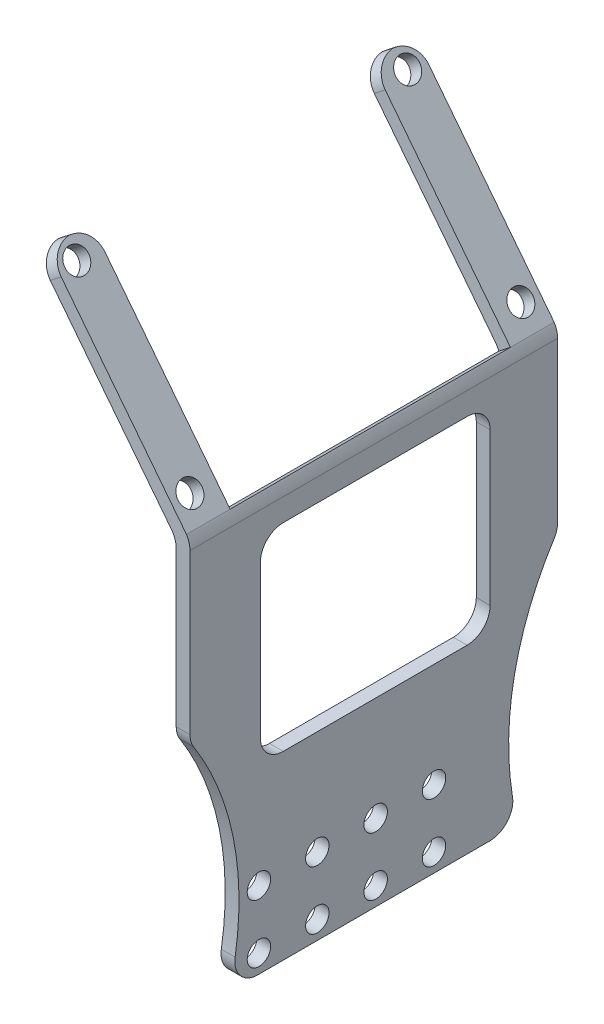
from build123d import *

# Parameters (mm, degrees)
SKETCH_1_W          = 3
SKETCH_1_H          = 90
EXTRUDE_1_DEPTH     = 80
SKETCH_2_R          = 2.6
CUT_EXTRUDE_1_DEPTH = 118.276484819
SKETCH_3_W          = 49.268401117
SKETCH_3_H          = 61
CUT_EXTRUDE_2_DEPTH = 118.276484819
SKETCH_4_R          = 2.55
CUT_EXTRUDE_3_DEPTH = 121.608375453
CUT_EXTRUDE_4_DEPTH = 121.608375453
FILLET_2_R          = 5
SKETCH_6_W          = 50
SKETCH_6_H          = 43.1
CUT_EXTRUDE_6_DEPTH = 121.608375453
FILLET_3_R          = 5


with BuildPart() as part:
    # 草图1 → 凸台-拉伸1 (new body)
    with BuildSketch(Plane.XY):
        Polygon((-1.18201613, 42.576507787), (-31.965089897, 81.977045467), (-29.601057636, 83.824029893), (1.18201613, 44.423492213), align=None)
        Rectangle(SKETCH_1_W, SKETCH_1_H)
    extrude(amount=EXTRUDE_1_DEPTH)

    # 草图2 → 切除-拉伸1 (cut, through all)
    with BuildSketch(Plane(origin=(22.285948177, 17.411690984, 0), x_dir=(0.6156614753256597, -0.788010753606721, 0), z_dir=(0.788010753606721, 0.6156614753256597, 0))):
        with Locations(Location((-80.278467782, -4, 0), (0, 0, 180))):
            Circle(SKETCH_2_R)
        with Locations(Location((-80.278467782, -76, 0), (0, 0, 180))):
            Circle(SKETCH_2_R)
        with Locations(Location((-40.278467782, -4, 0), (0, 0, 180))):
            Circle(SKETCH_2_R)
        with Locations(Location((-40.278467782, -76, 0), (0, 0, 180))):
            Circle(SKETCH_2_R)
    extrude(amount=-CUT_EXTRUDE_1_DEPTH, mode=Mode.SUBTRACT)

    # 草图3 → 切除-拉伸2 (cut, through all)
    with BuildSketch(Plane(origin=(22.285948177, 17.411690984, 0), x_dir=(0.6156614753256597, -0.788010753606721, 0), z_dir=(0.788010753606721, 0.6156614753256597, 0))):
        with Locations((-59.644267224, -40)):
            Rectangle(SKETCH_3_W, SKETCH_3_H)
    extrude(amount=-CUT_EXTRUDE_2_DEPTH, mode=Mode.SUBTRACT)

    # 草图4 → 切除-拉伸3 (cut, through all)
    with BuildSketch(Plane(origin=(1.5, 0, 0), x_dir=(0, 0, -1), z_dir=(1, 0, 0))):
        with Locations(Location((-65, -28.3, 0), (0, 0, 90))):
            Circle(SKETCH_4_R)
        with Locations(Location((-65, -41, 0), (0, 0, 90))):
            Circle(SKETCH_4_R)
        with Locations(Location((-52.3, -28.3, 0), (0, 0, 90))):
            Circle(SKETCH_4_R)
        with Locations(Location((-52.3, -41, 0), (0, 0, 90))):
            Circle(SKETCH_4_R)
        with Locations(Location((-39.6, -28.3, 0), (0, 0, 90))):
            Circle(SKETCH_4_R)
        with Locations(Location((-39.6, -41, 0), (0, 0, 90))):
            Circle(SKETCH_4_R)
        with Locations(Location((-26.9, -28.3, 0), (0, 0, 90))):
            Circle(SKETCH_4_R)
        with Locations(Location((-26.9, -41, 0), (0, 0, 90))):
            Circle(SKETCH_4_R)
    extrude(amount=-CUT_EXTRUDE_3_DEPTH, mode=Mode.SUBTRACT)

    # 草图5 → 切除-拉伸4 (cut, through all)
    with BuildSketch(Plane(origin=(1.5, 0, 0), x_dir=(0, 0, -1), z_dir=(1, 0, 0))):
        with BuildLine():
            Line((-80, 6.141923624), (-80, -45))
            Line((-80, -45), (-71.424177932, -45))
            ThreePointArc((-71.424177932, -45), (-70.206204317, -18.505774381), (-80, 6.141923624))
        make_face()
        with BuildLine():
            Line((0, -45), (-8.575822068, -45))
            ThreePointArc((-8.575822068, -45), (-9.793795683, -18.505774381), (0, 6.141923624))
            Line((0, 6.141923624), (0, -45))
        make_face()
    extrude(amount=-CUT_EXTRUDE_4_DEPTH, mode=Mode.SUBTRACT)

    # 圆角2
    # the kernel refuses this fillet: 5 mm, written as the material it adds along each edge
    with BuildSketch(Plane(origin=(-1.5, 42.98350858, 80), x_dir=(-0.61566147532566, 0.7880107536067206, 0), z_dir=(0, 0, -1))) as fillet_2_piece_1_section:
        with BuildLine():
            CenterArc((FILLET_2_R * 0.34432761329, -FILLET_2_R), FILLET_2_R, 90, 38)
            Line((-FILLET_2_R * 0.271333862036, -FILLET_2_R * 0.211989246393), (0, 0))
            Line((0, 0), (FILLET_2_R * 0.34432761329, 0))
        make_face()
    fillet_2_piece_1 = extrude(amount=84.304095166, mode=Mode.PRIVATE)
    fillet_2_piece_1 = split(fillet_2_piece_1, bisect_by=Plane(origin=(-1.5, 42.98350858, 70.5), z_dir=(0, 0, 1)), keep=Keep.TOP, mode=Mode.PRIVATE)
    add(fillet_2_piece_1)
    with BuildSketch(Plane(origin=(-1.5, 42.98350858, 84.304095166), x_dir=(-0.61566147532566, 0.7880107536067206, 0), z_dir=(0, 0, -1))) as fillet_2_piece_2_section:
        with BuildLine():
            CenterArc((FILLET_2_R * 0.34432761329, -FILLET_2_R), FILLET_2_R, 90, 38)
            Line((-FILLET_2_R * 0.271333862036, -FILLET_2_R * 0.211989246393), (0, 0))
            Line((0, 0), (FILLET_2_R * 0.34432761329, 0))
        make_face()
    fillet_2_piece_2 = extrude(amount=84.304095166, mode=Mode.PRIVATE)
    fillet_2_piece_2 = split(fillet_2_piece_2, bisect_by=Plane(origin=(-1.632433378, 43.153015574, 84.304095166), z_dir=(0.6156614753256597, -0.7880107536067209, 0)), keep=Keep.TOP, mode=Mode.PRIVATE)
    fillet_2_piece_2 = split(fillet_2_piece_2, bisect_by=Plane(origin=(-1.5, 42.98350858, 70.5), z_dir=(0, 0, -1)), keep=Keep.TOP, mode=Mode.PRIVATE)
    add(fillet_2_piece_2)
    with BuildSketch(Plane(origin=(-1.5, 42.98350858, 84.304095166), x_dir=(-0.61566147532566, 0.7880107536067206, 0), z_dir=(0, 0, -1))) as fillet_2_piece_3_section:
        with BuildLine():
            CenterArc((FILLET_2_R * 0.34432761329, -FILLET_2_R), FILLET_2_R, 90, 38)
            Line((-FILLET_2_R * 0.271333862036, -FILLET_2_R * 0.211989246393), (0, 0))
            Line((0, 0), (FILLET_2_R * 0.34432761329, 0))
        make_face()
    fillet_2_piece_3 = extrude(amount=84.304095166, mode=Mode.PRIVATE)
    fillet_2_piece_3 = split(fillet_2_piece_3, bisect_by=Plane(origin=(-1.5, 42.98350858, 9.5), z_dir=(0, 0, -1)), keep=Keep.TOP, mode=Mode.PRIVATE)
    add(fillet_2_piece_3)
    # the kernel refuses this fillet: 5 mm, written as the material it takes off along each edge
    with BuildSketch(Plane(origin=(1.5, 45, -6.658439614), x_dir=(0, -1, 0), z_dir=(0, 0, 1))) as fillet_2_2_piece_1:
        with BuildLine():
            CenterArc((2.663375846, -5), FILLET_2_R, 90, 32.186384057)
            Line((0, -0.768401117), (0, 0))
            Line((0, 0), (2.663375846, 0))
        make_face()
    extrude(amount=93.316879228, mode=Mode.SUBTRACT)

    # 草图6 → 切除-拉伸6 (cut, through all)
    with BuildSketch(Plane(origin=(1.5, 0, 0), x_dir=(0, 0, -1), z_dir=(1, 0, 0))):
        with Locations((-39.698542008, 15.9)):
            Rectangle(SKETCH_6_W, SKETCH_6_H)
    extrude(amount=-CUT_EXTRUDE_6_DEPTH, mode=Mode.SUBTRACT)

    # 圆角3
    # the kernel refuses this fillet: 5 mm, written as the material it adds along each edge
    with BuildSketch(Plane(origin=(1.5, -5.65, 14.698542008), x_dir=(0, 1, 0), z_dir=(-1, 0, 0)), Plane(origin=(1.5, -5.65, 64.698542008), x_dir=(0, 0, -1), z_dir=(-1, 0, 0)), Plane(origin=(1.5, 37.45, 64.698542008), x_dir=(0, -1, 0), z_dir=(-1, 0, 0))) as fillet_3_piece_1:
        with BuildLine():
            CenterArc((FILLET_3_R, -FILLET_3_R), FILLET_3_R, 90, 90)
            Line((0, -FILLET_3_R), (0, 0))
            Line((0, 0), (FILLET_3_R, 0))
        make_face()
    extrude(amount=3)
    with BuildSketch(Plane(origin=(1.5, 37.45, 14.698542008), x_dir=(0, -1, 0), z_dir=(-1, 0, 0))) as fillet_3_piece_2:
        with BuildLine():
            CenterArc((FILLET_3_R, FILLET_3_R), FILLET_3_R, 180, 90)
            Line((0, FILLET_3_R), (0, 0))
            Line((0, 0), (FILLET_3_R, 0))
        make_face()
    extrude(amount=3)
    # the kernel refuses this fillet: 5 mm, written as the material it takes off along each edge
    with BuildSketch(Plane(origin=(-41.815224317, 74.281277026, 0), x_dir=(0.6156614753256596, -0.7880107536067208, 0), z_dir=(0.7880107536067208, 0.6156614753256597, 0)), Plane(origin=(-19.750923216, 91.519798335, 9.5), x_dir=(0.6156614753256597, -0.7880107536067208, 1.0658141036401496e-15), z_dir=(-0.7880107536067209, -0.6156614753256597, 0))) as fillet_3_2_piece_1:
        with BuildLine():
            CenterArc((FILLET_3_R, -FILLET_3_R), FILLET_3_R, 90, 90)
            Line((0, -FILLET_3_R), (0, 0))
            Line((0, 0), (FILLET_3_R, 0))
        make_face()
    extrude(amount=28, mode=Mode.SUBTRACT)
    with BuildSketch(Plane(origin=(-41.815224317, 74.281277026, 80), x_dir=(0.6156614753256597, -0.7880107536067208, 0), z_dir=(0.7880107536067208, 0.6156614753256597, 0)), Plane(origin=(-19.750923216, 91.519798335, 70.5), x_dir=(0.6156614753256597, -0.7880107536067208, 0), z_dir=(-0.7880107536067209, -0.6156614753256597, 0))) as fillet_3_2_piece_2:
        with BuildLine():
            CenterArc((FILLET_3_R, FILLET_3_R), FILLET_3_R, 180, 90)
            Line((0, FILLET_3_R), (0, 0))
            Line((0, 0), (FILLET_3_R, 0))
        make_face()
    extrude(amount=28, mode=Mode.SUBTRACT)
    with BuildSketch(Plane(origin=(5.221396316, 6.141923624, 0), x_dir=(0, 1, 0), z_dir=(-1, 0, 0))) as fillet_3_2_piece_3:
        with BuildLine():
            CenterArc((1.488558526, -5), FILLET_3_R, 90, 32.518664638)
            ThreePointArc((-1.199313086, -0.783918147), (-0.597427923, -0.395368629), (0, 0))
            Line((0, 0), (1.488558526, 0))
        make_face()
    extrude(amount=10.442792632, mode=Mode.SUBTRACT)
    with BuildSketch(Plane(origin=(5.221396316, 6.141923624, 80), x_dir=(0, 1, 0), z_dir=(-1, 0, 0))) as fillet_3_2_piece_4:
        with BuildLine():
            CenterArc((1.488558526, 5), FILLET_3_R, 237.481335362, 32.518664638)
            ThreePointArc((-1.199313086, 0.783918147), (-0.597427923, 0.395368629), (0, 0))
            Line((0, 0), (1.488558526, 0))
        make_face()
    extrude(amount=10.442792632, mode=Mode.SUBTRACT)
    with BuildSketch(Plane(origin=(16.943632487, -45, 71.424177932), x_dir=(0, 0, -1), z_dir=(-1, 0, 0))) as fillet_3_2_piece_5:
        with BuildLine():
            CenterArc((6.177452995, -5), FILLET_3_R, 90, 99.373749783)
            ThreePointArc((1.244218563, -5.814369722), (0.69074329, -2.892497851), (0, 0))
            Line((0, 0), (6.177452995, 0))
        make_face()
    extrude(amount=33.887264974, mode=Mode.SUBTRACT)
    with BuildSketch(Plane(origin=(16.943632487, -45, 8.575822068), x_dir=(0, 0.9778615645016191, 0.20925286299223153), z_dir=(-1, 0, 0))) as fillet_3_2_piece_6:
        with BuildLine():
            CenterArc((6.181957548, -4.994429535), FILLET_3_R, 92.704821928, 99.373749783)
            Line((1.292649725, -6.04069385), (0, 0))
            ThreePointArc((0, 0), (2.973002485, -0.070187858), (5.946004969, 0))
        make_face()
    extrude(amount=33.887264974, mode=Mode.SUBTRACT)


solid = part.part
